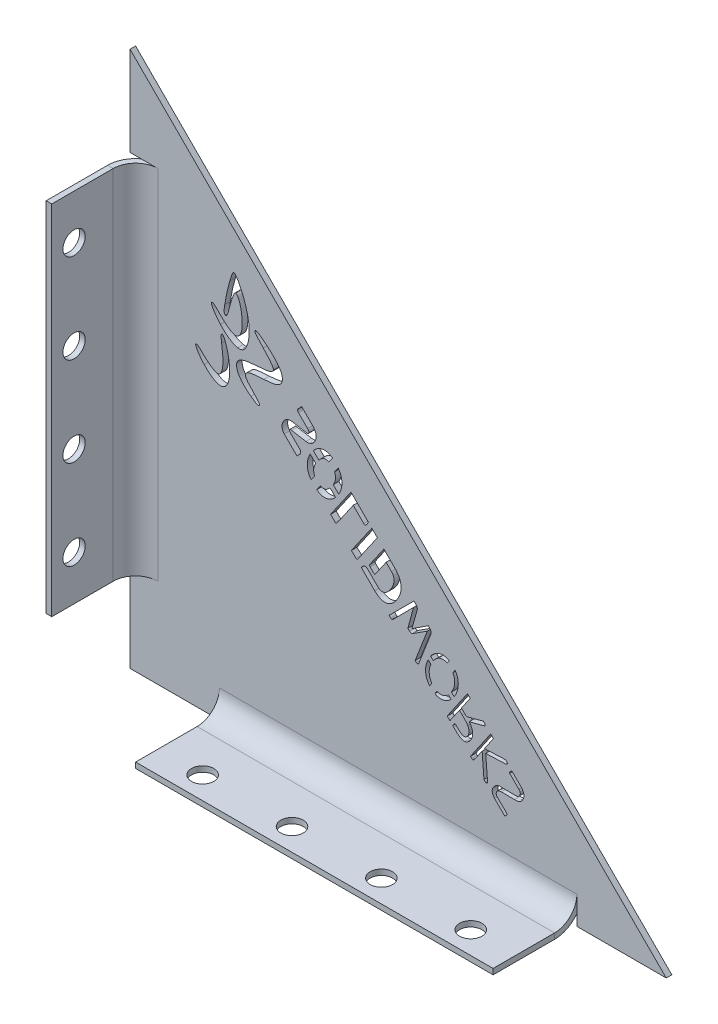
from build123d import *

# Parameters (mm, degrees)
BOSS_EXTRUDE1_DEPTH          = 1.5875
SKETCH7_W                    = 1.5875
SKETCH7_H                    = 101.6
BOSS_EXTRUDE2_DEPTH          = 0.0254
EDGE_FLANGE1_STRIP_W         = 19.05
EDGE_FLANGE1_STRIP_H         = 1.5875
EDGE_FLANGE1_STRIP_CUT_DEPTH = 101.6
EDGE_FLANGE1_DEPTH           = 101.6
SKETCH11_W                   = 101.6
SKETCH11_H                   = 1.5875
BOSS_EXTRUDE3_DEPTH          = 0.0254
EDGE_FLANGE2_STRIP_W         = 19.05
EDGE_FLANGE2_STRIP_H         = 1.5875
EDGE_FLANGE2_STRIP_CUT_DEPTH = 101.6
EDGE_FLANGE2_DEPTH           = 101.6
SKETCH15_R                   = 3.175
CUT_EXTRUDE1_DEPTH           = 2.54
SKETCH16_R                   = 3.175
CUT_EXTRUDE2_DEPTH           = 2.54
CUT_EXTRUDE13_DEPTH          = 2.54


# Sheet-metal steps are written as plain solids
with BuildPart() as part:
    # Sketch1 → Boss-Extrude1 (new body)
    with BuildSketch(Plane.XY):
        Polygon((0, 119.481843199), (0, -32.918156801), (152.4, -32.918156801), align=None)
    extrude(amount=BOSS_EXTRUDE1_DEPTH)

    # Sketch7 → Boss-Extrude2 (add)
    with BuildSketch(Plane.ZY):
        with Locations((0.79375, 43.281843199)):
            Rectangle(SKETCH7_W, SKETCH7_H)
    extrude(amount=BOSS_EXTRUDE2_DEPTH)

    # Edge-Flange1 strip (across the edge) → Edge-Flange1 strip cut (cut)
    with BuildSketch(Plane(origin=(-0.0254, 94.081843199, 1.5875), x_dir=(1, 0, 0), z_dir=(0, -1, 0))):
        with Locations((-1.5875, -0.79375)):
            Rectangle(EDGE_FLANGE1_STRIP_W, EDGE_FLANGE1_STRIP_H)
    extrude(amount=EDGE_FLANGE1_STRIP_CUT_DEPTH, mode=Mode.SUBTRACT)

    # Edge-Flange1 section (across the edge) → Edge-Flange1 (add)
    with BuildSketch(Plane(origin=(-0.0254, 94.081843199, 1.5875), x_dir=(1, 0, 0), z_dir=(0, -1, 0))):
        with BuildLine():
            Line((0, 6.35), (0, 23.8125))
            Line((0, 23.8125), (1.5875, 23.8125))
            Line((1.5875, 23.8125), (1.5875, 6.35))
            ThreePointArc((1.5875, 6.35), (3.447371939, 1.859871939), (7.9375, 0))
            Line((7.9375, 0), (7.9375, -1.5875))
            ThreePointArc((7.9375, -1.5875), (2.324839924, 0.737339924), (0, 6.35))
        make_face()
    extrude(amount=EDGE_FLANGE1_DEPTH)

    # Sketch11 → Boss-Extrude3 (add)
    with BuildSketch(Plane(origin=(0, -32.918156801, 0), x_dir=(-1, 0, 0), z_dir=(0, -1, 0))):
        with Locations((-76.2, -0.79375)):
            Rectangle(SKETCH11_W, SKETCH11_H)
    extrude(amount=BOSS_EXTRUDE3_DEPTH)

    # Edge-Flange2 strip (across the edge) → Edge-Flange2 strip cut (cut)
    with BuildSketch(Plane(origin=(25.4, -32.943556801, 1.5875), x_dir=(0, 1, 0), z_dir=(1, 0, 0))):
        with Locations((-1.5875, -0.79375)):
            Rectangle(EDGE_FLANGE2_STRIP_W, EDGE_FLANGE2_STRIP_H)
    extrude(amount=EDGE_FLANGE2_STRIP_CUT_DEPTH, mode=Mode.SUBTRACT)

    # Edge-Flange2 section (across the edge) → Edge-Flange2 (add)
    with BuildSketch(Plane(origin=(25.4, -32.943556801, 1.5875), x_dir=(0, 1, 0), z_dir=(1, 0, 0))):
        with BuildLine():
            Line((0, 6.35), (0, 23.8125))
            Line((0, 23.8125), (1.5875, 23.8125))
            Line((1.5875, 23.8125), (1.5875, 6.35))
            ThreePointArc((1.5875, 6.35), (3.447371939, 1.859871939), (7.9375, 0))
            Line((7.9375, 0), (7.9375, -1.5875))
            ThreePointArc((7.9375, -1.5875), (2.324839924, 0.737339924), (0, 6.35))
        make_face()
    extrude(amount=EDGE_FLANGE2_DEPTH)

    # Sketch15 → Cut-Extrude1 (cut)
    with BuildSketch(Plane(origin=(0, -31.356056801, 0), x_dir=(1, 0, 0), z_dir=(0, 1, 0))):
        with Locations(Location((38.1, -19.05, 0), (0, 0, 270))):
            Circle(SKETCH15_R)
        with Locations(Location((63.5, -19.05, 0), (0, 0, 270))):
            Circle(SKETCH15_R)
        with Locations(Location((88.9, -19.05, 0), (0, 0, 270))):
            Circle(SKETCH15_R)
        with Locations(Location((114.3, -19.05, 0), (0, 0, 270))):
            Circle(SKETCH15_R)
    extrude(amount=-CUT_EXTRUDE1_DEPTH, mode=Mode.SUBTRACT)

    # Sketch16 → Cut-Extrude2 (cut)
    with BuildSketch(Plane(origin=(1.5621, 0, 0), x_dir=(0, 0, -1), z_dir=(1, 0, 0))):
        with Locations((-19.05, 81.381843199)):
            Circle(SKETCH16_R)
        with Locations((-19.05, 55.981843199)):
            Circle(SKETCH16_R)
        with Locations((-19.05, 30.581843199)):
            Circle(SKETCH16_R)
        with Locations((-19.05, 5.181843199)):
            Circle(SKETCH16_R)
    extrude(amount=-CUT_EXTRUDE2_DEPTH, mode=Mode.SUBTRACT)

    # Sketch17 → Cut-Extrude13 (cut)
    with BuildSketch(Plane.XY):
        with BuildLine():
            Line((84.721707755, 11.622520957), (85.505242554, 10.840701105))
            add(Edge.make_bspline(
                [(85.758282427, 6.326548481), (84.987712449, 7.45790861), (84.704291863, 9.048216028), (85.505242554, 10.840701105)],
                knots=[0.183752031, 0.183752031, 0.183752031, 0.183752031, 0.900404734, 0.900404734, 0.900404734, 0.900404734], degree=3))
            Line((85.758282427, 6.326548481), (85.168963635, 5.374216856))
            add(Edge.make_bspline(
                [(84.721707755, 11.622520957), (83.710532317, 9.544605504), (83.647013648, 7.213000638), (85.168963635, 5.374216856)],
                knots=[0.087575575, 0.087575575, 0.087575575, 0.087575575, 0.889589698, 0.889589698, 0.889589698, 0.889589698], degree=3))
        make_face()
        with BuildLine():
            Line((51.445463807, 39.221199309), (52.510429012, 40.680868742))
            add(Edge.make_bspline(
                [(52.510429012, 40.680868742), (51.997568519, 41.660838846), (52.103698081, 42.720219463), (52.76654826, 43.906113031)],
                knots=[0.215987469, 0.215987469, 0.215987469, 0.215987469, 0.865125096, 0.865125096, 0.865125096, 0.865125096], degree=3))
            Line((52.76654826, 43.906113031), (51.19475958, 45.443832105))
            add(Edge.make_bspline(
                [(51.19475958, 45.443832105), (50.1334678, 43.525079377), (49.985777468, 41.262248875), (51.445463807, 39.221199309)],
                knots=[0.108043754, 0.108043754, 0.108043754, 0.108043754, 0.883180659, 0.883180659, 0.883180659, 0.883180659], degree=3))
        make_face()
        with BuildLine():
            Line((92.11703209, 6.171171914), (91.343664825, 6.942846486))
            add(Edge.make_bspline(
                [(91.360591146, 6.970153244), (91.354954521, 6.961018679), (91.349312399, 6.951916445), (91.343664825, 6.942846486)],
                knots=[0, 0, 0, 0, 0.003649159, 0.003649159, 0.003649159, 0.003649159], degree=3))
            add(Edge.make_bspline(
                [(91.763716495, 11.887071982), (92.477869446, 10.629316693), (92.556518643, 8.91297866), (91.360591146, 6.970153244)],
                knots=[0.239450652, 0.239450652, 0.239450652, 0.239450652, 1, 1, 1, 1], degree=3))
            Line((91.763716495, 11.887071982), (92.381332766, 12.817587465))
            add(Edge.make_bspline(
                [(92.180313996, 6.271756537), (93.463597374, 8.35283708), (93.771196619, 10.816829081), (92.381332766, 12.817587465)],
                knots=[0, 0, 0, 0, 0.836009541, 0.836009541, 0.836009541, 0.836009541], degree=3))
            add(Edge.make_bspline(
                [(92.11703209, 6.171171914), (92.138383386, 6.20447253), (92.159478844, 6.238003186), (92.180313996, 6.271756537)],
                knots=[0.98494769, 0.98494769, 0.98494769, 0.98494769, 1, 1, 1, 1], degree=3))
        make_face()
        with BuildLine():
            Line((93.619394476, 3.631709578), (90.901456611, -0.336750328))
            Line((90.901456611, -0.336750328), (90.138423725, 0.426833781))
            Line((90.138423725, 0.426833781), (95.903726954, 8.821206607))
            Line((95.903726954, 8.821206607), (96.682795231, 8.041575523))
            Line((96.682795231, 8.041575523), (94.189502794, 4.449340015))
            Line((94.189502794, 4.449340015), (95.614058846, 3.036587601))
            Line((95.614058846, 3.036587601), (100.412492775, 4.30918361))
            Line((100.412492775, 4.30918361), (100.808972967, 3.912416997))
            add(Edge.make_bspline(
                [(100.944654432, 3.663274364), (100.929725408, 3.768049176), (100.876299846, 3.84504148), (100.808972967, 3.912416997)],
                knots=[0, 0, 0, 0, 1, 1, 1, 1], degree=3))
            add(Edge.make_bspline(
                [(100.841921854, 3.381078513), (100.910366712, 3.447335278), (100.963860266, 3.560637463), (100.944654432, 3.663274364)],
                knots=[0, 0, 0, 0, 1, 1, 1, 1], degree=3))
            add(Edge.make_bspline(
                [(100.483729752, 3.228330831), (100.740323521, 3.279553524), (100.841921854, 3.381078513)],
                knots=[0, 0, 0, 1, 1, 1], degree=2))
            Line((100.483729752, 3.228330831), (96.408058464, 2.1585972))
            add(Edge.make_bspline(
                [(96.852310832, -2.1317307), (97.243809214, -1.522502732), (98.031270337, 0.215515479), (96.408058464, 2.1585972)],
                knots=[0, 0, 0, 0, 1, 1, 1, 1], degree=3))
            add(Edge.make_bspline(
                [(95.170240864, -3.314580371), (95.843769004, -3.272061019), (96.532479446, -2.630868637), (96.852310832, -2.1317307)],
                knots=[0, 0, 0, 0, 1, 1, 1, 1], degree=3))
            add(Edge.make_bspline(
                [(91.956250184, -1.392305894), (93.030274382, -2.467105977), (93.988893063, -3.394333859), (95.170240864, -3.314580371)],
                knots=[0, 0, 0, 0, 1, 1, 1, 1], degree=3))
            Line((91.956250184, -1.392305894), (91.699567709, -1.135437988))
            Line((91.699567709, -1.135437988), (92.32273585, -0.237403331))
            add(Edge.make_bspline(
                [(93.48822557, -1.385375982), (93.246732808, -1.169082314), (92.763450941, -0.684887464), (92.32273585, -0.237403331)],
                knots=[0, 0, 0, 0, 0.564910355, 0.564910355, 0.564910355, 0.564910355], degree=3))
            add(Edge.make_bspline(
                [(93.921068141, -1.743669219), (93.817395042, -1.672004539), (93.660289486, -1.540452428), (93.48822557, -1.385375982)],
                knots=[0, 0, 0, 0, 1, 1, 1, 1], degree=3))
            add(Edge.make_bspline(
                [(94.883074119, -2.171643467), (94.602980775, -2.167266293), (94.319732567, -2.016425741), (93.921068141, -1.743669219)],
                knots=[0, 0, 0, 0, 1, 1, 1, 1], degree=3))
            add(Edge.make_bspline(
                [(95.977880574, 1.0148503), (96.785586905, -0.394471637), (96.077212099, -2.20093934), (94.883074119, -2.171643467)],
                knots=[0, 0, 0, 0, 1, 1, 1, 1], degree=3))
            add(Edge.make_bspline(
                [(94.446560637, 2.823196427), (95.076013707, 2.193288634), (95.664842256, 1.563394792), (95.977880574, 1.0148503)],
                knots=[0, 0, 0, 0, 1, 1, 1, 1], degree=3))
            add(Edge.make_bspline(
                [(93.619394476, 3.631709578), (93.900460659, 3.358995517), (94.222136695, 3.045643704), (94.446560637, 2.823196427)],
                knots=[0, 0, 0, 0, 1, 1, 1, 1], degree=3))
        make_face()
        with BuildLine():
            Line((86.209196401, 12.066076945), (85.443485586, 12.830111825))
            add(Edge.make_bspline(
                [(90.730488829, 14.361570374), (88.727487913, 15.496506982), (86.72434244, 14.567710628), (85.443485586, 12.830111825)],
                knots=[0.087278425, 0.087278425, 0.087278425, 0.087278425, 0.918005408, 0.918005408, 0.918005408, 0.918005408], degree=3))
            Line((90.730488829, 14.361570374), (90.164071414, 13.446247084))
            add(Edge.make_bspline(
                [(86.209196401, 12.066076945), (87.459941732, 13.821438038), (88.927520745, 14.057479012), (90.164071414, 13.446247084)],
                knots=[0.065880131, 0.065880131, 0.065880131, 0.065880131, 0.862540536, 0.862540536, 0.862540536, 0.862540536], degree=3))
        make_face()
        with BuildLine():
            Line((90.500625434, 5.856251769), (91.25986179, 5.098677177))
            add(Edge.make_bspline(
                [(86.635335403, 4.160530072), (88.316134594, 3.2833491), (90.009378432, 3.845450844), (91.25986179, 5.098677177)],
                knots=[0.104022508, 0.104022508, 0.104022508, 0.104022508, 0.806991479, 0.806991479, 0.806991479, 0.806991479], degree=3))
            Line((86.635335403, 4.160530072), (87.232423338, 5.060117069))
            add(Edge.make_bspline(
                [(90.500625434, 5.856251769), (89.427683871, 4.774352876), (88.253131249, 4.616069243), (87.232423338, 5.060117069)],
                knots=[0.178248537, 0.178248537, 0.178248537, 0.178248537, 0.823949969, 0.823949969, 0.823949969, 0.823949969], degree=3))
        make_face()
        with BuildLine():
            Line((59.173354737, 45.98521522), (58.104637652, 44.520403361))
            add(Edge.make_bspline(
                [(58.104637652, 44.520403361), (58.624312063, 43.509829281), (58.486845573, 42.415026806), (57.758816103, 41.181540941)],
                knots=[0.220601271, 0.220601271, 0.220601271, 0.220601271, 0.889658399, 0.889658399, 0.889658399, 0.889658399], degree=3))
            Line((57.758816103, 41.181540941), (59.331913265, 39.642541746))
            add(Edge.make_bspline(
                [(59.331913265, 39.642541746), (60.45921991, 41.585887069), (60.653244066, 43.90092567), (59.173354737, 45.98521522)],
                knots=[0.08979709, 0.08979709, 0.08979709, 0.08979709, 0.881059413, 0.881059413, 0.881059413, 0.881059413], degree=3))
        make_face()
        with BuildLine():
            Line((53.662340512, 45.189222593), (52.086221637, 46.731178003))
            add(Edge.make_bspline(
                [(57.568679838, 47.613840901), (55.520065822, 49.093943076), (53.553275424, 48.448735158), (52.086221637, 46.731178003)],
                knots=[0.108544123, 0.108544123, 0.108544123, 0.108544123, 0.92409509, 0.92409509, 0.92409509, 0.92409509], degree=3))
            Line((57.568679838, 47.613840901), (56.504063464, 46.154649585))
            add(Edge.make_bspline(
                [(53.662340512, 45.189222593), (54.61089034, 46.300828986), (55.536870486, 46.648456561), (56.504063464, 46.154649585)],
                knots=[0.099972059, 0.099972059, 0.099972059, 0.099972059, 0.794712313, 0.794712313, 0.794712313, 0.794712313], degree=3))
        make_face()
        with BuildLine():
            Line((56.84156153, 39.919428489), (58.418387809, 38.376781009))
            add(Edge.make_bspline(
                [(53.054081382, 37.597977564), (55.04976389, 36.166398246), (56.967204324, 36.750170518), (58.418387809, 38.376781009)],
                knots=[0.110680721, 0.110680721, 0.110680721, 0.110680721, 0.905933238, 0.905933238, 0.905933238, 0.905933238], degree=3))
            Line((53.054081382, 37.597977564), (54.119183475, 39.05783462))
            add(Edge.make_bspline(
                [(56.84156153, 39.919428489), (55.935669711, 38.906003102), (55.046091738, 38.595436594), (54.119183475, 39.05783462)],
                knots=[0.124259191, 0.124259191, 0.124259191, 0.124259191, 0.79018155, 0.79018155, 0.79018155, 0.79018155], degree=3))
        make_face()
        with BuildLine():
            Line((108.496762476, -3.86941452), (111.3864901, -6.767368702))
            add(Edge.make_bspline(
                [(111.3864901, -6.767368702), (112.561547128, -8.376297819), (111.244223221, -9.960736931)],
                knots=[0, 0, 0, 1, 1, 1], degree=2))
            add(Edge.make_bspline(
                [(111.244223221, -9.960736931), (110.391101426, -10.65173837), (109.268361741, -10.567012718)],
                knots=[0, 0, 0, 1, 1, 1], degree=2))
            Line((109.268361741, -10.567012718), (105.526638444, -10.526041213))
            add(Edge.make_bspline(
                [(105.526638444, -10.526041213), (104.930541488, -10.516484149), (104.41789044, -10.870435939)],
                knots=[0, 0, 0, 1, 1, 1], degree=2))
            add(Edge.make_bspline(
                [(104.41789044, -10.870435939), (103.685620288, -11.673429456), (104.49427114, -12.502306534)],
                knots=[0, 0, 0, 1, 1, 1], degree=2))
            Line((104.49427114, -12.502306534), (107.122144424, -15.101175717))
            add(Edge.make_bspline(
                [(107.071688836, -15.499933962), (107.270701008, -15.330066072), (107.122144424, -15.101175717)],
                knots=[0, 0, 0, 1, 1, 1], degree=2))
            Line((107.071688836, -15.499933962), (106.534891807, -16.040425924))
            Line((106.534891807, -16.040425924), (103.615255498, -13.140748949))
            add(Edge.make_bspline(
                [(103.753238565, -9.960736931), (102.194590608, -11.376548682), (103.615255498, -13.140748949)],
                knots=[0, 0, 0, 1, 1, 1], degree=2))
            add(Edge.make_bspline(
                [(105.536650499, -9.370683255), (104.526262329, -9.287104603), (103.753238565, -9.960736931)],
                knots=[0, 0, 0, 1, 1, 1], degree=2))
            Line((105.536650499, -9.370683255), (109.472939745, -9.442971907))
            add(Edge.make_bspline(
                [(110.583848929, -9.062941846), (110.107843335, -9.464729066), (109.472939745, -9.442971907)],
                knots=[0, 0, 0, 1, 1, 1], degree=2))
            add(Edge.make_bspline(
                [(110.504262199, -7.39076176), (111.268971199, -8.185243143), (110.583848929, -9.062941846)],
                knots=[0, 0, 0, 1, 1, 1], degree=2))
            Line((110.504262199, -7.39076176), (107.891736672, -4.775452968))
            add(Edge.make_bspline(
                [(107.962033037, -4.394671871), (107.825859644, -4.565027913), (107.891736672, -4.775452968)],
                knots=[0, 0, 0, 1, 1, 1], degree=2))
            Line((107.962033037, -4.394671871), (108.496762476, -3.86941452))
        make_face()
        with BuildLine():
            Line((70.290623891, 34.388644753), (64.698621503, 26.304238707))
            add(Edge.make_bspline(
                [(64.698621503, 26.304238707), (64.605563614, 26.168501602), (64.393873546, 26.127952794), (64.251738703, 26.270190316)],
                knots=[0, 0, 0, 0, 1, 1, 1, 1], degree=3))
            Line((64.251738703, 26.270190316), (62.928711555, 27.594173231))
            Line((62.928711555, 27.594173231), (68.717525169, 35.962879897))
            Line((68.717525169, 35.962879897), (70.290623891, 34.388644753))
        make_face()
        with BuildLine():
            Line((67.777086105, 36.903998342), (67.199488157, 36.068196006))
            add(Edge.make_bspline(
                [(67.199488157, 36.068196006), (66.939568961, 35.693047315), (66.707575098, 35.674957198), (66.436130334, 35.946598057)],
                knots=[0, 0, 0, 0, 1, 1, 1, 1], degree=3))
            Line((66.436130334, 35.946598057), (63.429930485, 38.954969613))
            Line((63.429930485, 38.954969613), (58.77919786, 32.230078827))
            add(Edge.make_bspline(
                [(58.77919786, 32.230078827), (58.684002723, 32.096479077), (58.473381997, 32.054861591), (58.332315779, 32.196029717)],
                knots=[0, 0, 0, 0, 1, 1, 1, 1], degree=3))
            Line((58.332315779, 32.196029717), (57.00928863, 33.520012632))
            Line((57.00928863, 33.520012632), (62.797032129, 41.887649956))
            Line((62.797032129, 41.887649956), (67.777086105, 36.903998342))
        make_face()
        with BuildLine():
            Line((72.146922955, 32.531004681), (75.129611648, 29.546161265))
            add(Edge.make_bspline(
                [(75.129611648, 29.546161265), (77.33216344, 27.342018329), (77.8304891, 24.768593971), (75.689100546, 21.677624277)],
                knots=[0, 0, 0, 0, 1, 1, 1, 1], degree=3))
            add(Edge.make_bspline(
                [(75.689100546, 21.677624277), (74.046154195, 19.300611921), (71.7934214, 18.723059435), (69.547053885, 20.971049748)],
                knots=[0, 0, 0, 0, 1, 1, 1, 1], degree=3))
            Line((69.547053885, 20.971049748), (65.738273885, 24.782581247))
            Line((65.738273885, 24.782581247), (65.83346974, 24.916180279))
            add(Edge.make_bspline(
                [(65.83346974, 24.916180279), (66.224953453, 25.484783007), (66.82167998, 26.001996286), (67.581512314, 25.241615042)],
                knots=[0, 0, 0, 0, 1, 1, 1, 1], degree=3))
            Line((67.581512314, 25.241615042), (70.402830221, 22.418258988))
            add(Edge.make_bspline(
                [(70.402830221, 22.418258988), (71.519602237, 21.300680205), (72.755580871, 21.680821515), (73.996346572, 23.474268868)],
                knots=[0, 0, 0, 0, 1, 1, 1, 1], degree=3))
            add(Edge.make_bspline(
                [(73.996346572, 23.474268868), (75.132289541, 25.118084082), (75.446179402, 26.927901252), (74.309102819, 28.06579927)],
                knots=[0, 0, 0, 0, 1, 1, 1, 1], degree=3))
            Line((74.309102819, 28.06579927), (72.779820538, 29.596186318))
            Line((72.779820538, 29.596186318), (69.52281134, 24.890259491))
            Line((69.52281134, 24.890259491), (68.222226725, 26.191783661))
            add(Edge.make_bspline(
                [(68.222226725, 26.191783661), (68.046962396, 26.367174603), (68.053466727, 26.615196168), (68.146523844, 26.748795253)],
                knots=[0, 0, 0, 0, 1, 1, 1, 1], degree=3))
            Line((68.146523844, 26.748795253), (72.146922955, 32.531004681))
        make_face()
        with BuildLine():
            Line((47.444592965, 43.091617925), (43.813214541, 46.725619691))
            add(Edge.make_bspline(
                [(43.813214541, 46.725619691), (43.007429236, 47.531987103), (43.023978935, 48.957047288), (43.714940058, 49.90826821)],
                knots=[0, 0, 0, 0, 1, 1, 1, 1], degree=3))
            add(Edge.make_bspline(
                [(43.714940058, 49.90826821), (44.196258752, 50.566639632), (45.04099995, 51.060243708), (46.119619033, 50.868491442)],
                knots=[0, 0, 0, 0, 1, 1, 1, 1], degree=3))
            Line((46.119619033, 50.868491442), (49.960530836, 50.183969994))
            add(Edge.make_bspline(
                [(49.960530836, 50.183969994), (50.361403643, 50.110059983), (50.592321108, 50.105700566), (50.75489871, 50.325869368)],
                knots=[0, 0, 0, 0, 1, 1, 1, 1], degree=3))
            add(Edge.make_bspline(
                [(50.75489871, 50.325869368), (50.9763067, 50.632611748), (50.945391662, 50.877439795), (50.476240755, 51.346929622)],
                knots=[0, 0, 0, 0, 1, 1, 1, 1], degree=3))
            Line((50.476240755, 51.346929622), (47.846216531, 53.9788538))
            add(Edge.make_bspline(
                [(47.846216531, 53.9788538), (47.565153435, 54.260119938), (47.550291578, 54.550911046), (47.816622516, 54.919643363)],
                knots=[0, 0, 0, 0, 1, 1, 1, 1], degree=3))
            Line((47.816622516, 54.919643363), (48.797310754, 55.899623655))
            Line((48.797310754, 55.899623655), (51.878318566, 52.816390093))
            add(Edge.make_bspline(
                [(51.878318566, 52.816390093), (53.229131365, 51.464601454), (53.100314908, 50.00002629), (52.387961347, 49.018879381)],
                knots=[0, 0, 0, 0, 1, 1, 1, 1], degree=3))
            add(Edge.make_bspline(
                [(52.387961347, 49.018879381), (51.717323266, 48.096517257), (50.881203628, 47.795341883), (50.000346275, 47.943191188)],
                knots=[0, 0, 0, 0, 1, 1, 1, 1], degree=3))
            Line((50.000346275, 47.943191188), (45.890035082, 48.642776045))
            add(Edge.make_bspline(
                [(45.890035082, 48.642776045), (45.557575535, 48.697418459), (45.437830782, 48.673942045), (45.346917088, 48.555308322)],
                knots=[0, 0, 0, 0, 1, 1, 1, 1], degree=3))
            add(Edge.make_bspline(
                [(45.346917088, 48.555308322), (45.195039565, 48.360792609), (45.281550662, 48.130912779), (45.555133392, 47.857132411)],
                knots=[0, 0, 0, 0, 1, 1, 1, 1], degree=3))
            Line((45.555133392, 47.857132411), (48.301643336, 45.108638361))
            add(Edge.make_bspline(
                [(48.301643336, 45.108638361), (48.637209827, 44.772829454), (48.485208834, 44.238350721), (48.198557117, 43.845037799)],
                knots=[0, 0, 0, 0, 1, 1, 1, 1], degree=3))
            Line((48.198557117, 43.845037799), (47.444592965, 43.091617925))
        make_face()
        with BuildLine():
            Line((101.073637243, -3.295330304), (101.62070499, -10.032790136))
            add(Edge.make_bspline(
                [(101.62070499, -10.032790136), (101.635603133, -10.223088591), (101.467698679, -10.390871837)],
                knots=[0, 0, 0, 1, 1, 1], degree=2))
            add(Edge.make_bspline(
                [(101.467698679, -10.390871837), (101.401391786, -10.459268112), (101.29019051, -10.510543302), (101.186497338, -10.494469996)],
                knots=[0, 0, 0, 0, 1, 1, 1, 1], degree=3))
            add(Edge.make_bspline(
                [(101.186497338, -10.494469996), (101.081733333, -10.479465314), (101.005851289, -10.420638786), (100.937455014, -10.354331893)],
                knots=[0, 0, 0, 0, 1, 1, 1, 1], degree=3))
            Line((100.937455014, -10.354331893), (100.592270911, -10.008898425))
            Line((100.592270911, -10.008898425), (100.067661136, -3.251135517))
            Line((100.067661136, -3.251135517), (97.797931747, -6.487451382))
            add(Edge.make_bspline(
                [(97.797931747, -6.487451382), (97.674922448, -6.670217693), (97.497447422, -6.700087321), (97.391615566, -6.681875224)],
                knots=[0, 0, 0, 0, 1, 1, 1, 1], degree=3))
            add(Edge.make_bspline(
                [(97.391615566, -6.681875224), (97.278300203, -6.666866735), (97.17248219, -6.612306155), (97.094468357, -6.534235964)],
                knots=[0, 0, 0, 0, 1, 1, 1, 1], degree=3))
            Line((97.094468357, -6.534235964), (96.743941135, -6.183455518))
            Line((96.743941135, -6.183455518), (102.50924282, 2.206639833))
            Line((102.50924282, 2.206639833), (103.287242473, 1.428078144))
            Line((103.287242473, 1.428078144), (100.729764178, -2.27959227))
            Line((100.729764178, -2.27959227), (106.748702668, -2.031603621))
            Line((106.748702668, -2.031603621), (107.093886771, -2.377037089))
            add(Edge.make_bspline(
                [(107.093886771, -2.377037089), (107.160142765, -2.447619967), (107.21677646, -2.523543701), (107.230636141, -2.627248399)],
                knots=[0, 0, 0, 0, 1, 1, 1, 1], degree=3))
            add(Edge.make_bspline(
                [(107.230636141, -2.627248399), (107.24877407, -2.728816622), (107.197417046, -2.84425688), (107.127904282, -2.909444968)],
                knots=[0, 0, 0, 0, 1, 1, 1, 1], degree=3))
            add(Edge.make_bspline(
                [(107.127904282, -2.909444968), (107.000639017, -3.036618361), (106.768642839, -3.061122536)],
                knots=[0, 0, 0, 1, 1, 1], degree=2))
            Line((106.768642839, -3.061122536), (101.073637243, -3.295330304))
        make_face()
        with BuildLine():
            Line((85.489060514, 18.220998173), (82.076602895, 9.352180046))
            add(Edge.make_bspline(
                [(82.076602895, 9.352180046), (82.045575088, 9.282701304), (82.02845246, 9.233530883), (81.965353753, 9.168340478)],
                knots=[0, 0, 0, 0, 1, 1, 1, 1], degree=3))
            add(Edge.make_bspline(
                [(81.965353753, 9.168340478), (81.893698391, 9.092462348), (81.76645706, 9.031571862), (81.652072301, 9.04551029)],
                knots=[0, 0, 0, 0, 1, 1, 1, 1], degree=3))
            add(Edge.make_bspline(
                [(81.652072301, 9.04551029), (81.534480128, 9.058382303), (81.453252703, 9.118279053), (81.383787858, 9.187794079)],
                knots=[0, 0, 0, 0, 1, 1, 1, 1], degree=3))
            Line((81.383787858, 9.187794079), (81.027917518, 9.543921504))
            Line((81.027917518, 9.543921504), (84.509901798, 18.516414939))
            Line((84.509901798, 18.516414939), (80.457191211, 15.89866355))
            add(Edge.make_bspline(
                [(80.457191211, 15.89866355), (80.122482527, 15.647553461), (79.687385361, 15.682989323), (79.425569789, 15.977077346)],
                knots=[0, 0, 0, 0, 1, 1, 1, 1], degree=3))
            Line((79.425569789, 15.977077346), (78.963899247, 16.439081404))
            Line((78.963899247, 16.439081404), (80.57285425, 22.383583415))
            Line((80.57285425, 22.383583415), (74.701541405, 16.473761171))
            add(Edge.make_bspline(
                [(74.701541405, 16.473761171), (74.624539065, 16.392539923), (74.497296907, 16.327372679), (74.373290012, 16.342385029)],
                knots=[0, 0, 0, 0, 1, 1, 1, 1], degree=3))
            add(Edge.make_bspline(
                [(74.373290012, 16.342385029), (74.250351686, 16.354189244), (74.160572956, 16.416227101), (74.08469637, 16.492158501)],
                knots=[0, 0, 0, 0, 1, 1, 1, 1], degree=3))
            Line((74.08469637, 16.492158501), (73.621957203, 16.955231954))
            Line((73.621957203, 16.955231954), (80.701736329, 24.029900273))
            Line((80.701736329, 24.029900273), (81.29164817, 23.439562273))
            Line((81.29164817, 23.439562273), (81.290578775, 23.43849365))
            add(Edge.make_bspline(
                [(81.290578775, 23.43849365), (81.293785364, 23.435284744), (81.300197878, 23.43100639), (81.304472372, 23.426728807)],
                knots=[0, 0, 0, 0, 1, 1, 1, 1], degree=3))
            add(Edge.make_bspline(
                [(81.304472372, 23.426728807), (81.479738246, 23.255615341), (81.592986442, 23.054589121), (81.62818601, 22.833279178)],
                knots=[0, 0, 0, 0, 1, 1, 1, 1], degree=3))
            add(Edge.make_bspline(
                [(81.62818601, 22.833279178), (81.661254561, 22.633352355), (81.645140337, 22.416336979), (81.593743114, 22.187575236)],
                knots=[0, 0, 0, 0, 1, 1, 1, 1], degree=3))
            Line((81.593743114, 22.187575236), (80.102623419, 16.901575892))
            Line((80.102623419, 16.901575892), (84.757381315, 19.971325451))
            Line((84.757381315, 19.971325451), (85.248974755, 19.479376878))
            Line((85.248974755, 19.479376878), (85.263936204, 19.464404621))
            add(Edge.make_bspline(
                [(85.263936204, 19.464404621), (85.586677775, 19.141429898), (85.668830227, 18.682770623), (85.489060514, 18.220998173)],
                knots=[0, 0, 0, 0, 1, 1, 1, 1], degree=3))
        make_face()
        with BuildLine():
            add(Edge.make_bspline(
                [(20.72110866, 54.906976215), (20.284017897, 55.344382737), (19.231436318, 56.58808724), (18.735295858, 56.329552373)],
                knots=[0, 0, 0, 0, 1, 1, 1, 1], degree=3))
            add(Edge.make_bspline(
                [(18.735295858, 56.329552373), (18.328972676, 56.11374762), (19.465757433, 54.167635225), (21.080479871, 52.402022247)],
                knots=[0, 0, 0, 0, 1, 1, 1, 1], degree=3))
            add(Edge.make_bspline(
                [(21.080479871, 52.402022247), (22.708027229, 50.623575085), (25.060439679, 48.947497596), (26.56061046, 49.694233975)],
                knots=[0, 0, 0, 0, 1, 1, 1, 1], degree=3))
            add(Edge.make_bspline(
                [(26.56061046, 49.694233975), (29.016700501, 50.919567431), (28.584753446, 56.722620159), (27.188940356, 60.758852952)],
                knots=[0, 0, 0, 0, 1, 1, 1, 1], degree=3))
            add(Edge.make_bspline(
                [(27.188940356, 60.758852952), (26.845058028, 61.748933319), (26.530930242, 62.240817813), (26.339619628, 62.387349129)],
                knots=[0, 0, 0, 0, 1, 1, 1, 1], degree=3))
            add(Edge.make_bspline(
                [(26.339619628, 62.387349129), (26.158997458, 62.525324509), (25.983625045, 62.401375515), (25.933323466, 62.24637936)],
                knots=[0, 0, 0, 0, 1, 1, 1, 1], degree=3))
            add(Edge.make_bspline(
                [(25.933323466, 62.24637936), (25.835933952, 61.956696357), (25.880533422, 61.122808818), (26.037320131, 60.108207346)],
                knots=[0, 0, 0, 0, 1, 1, 1, 1], degree=3))
            add(Edge.make_bspline(
                [(26.037320131, 60.108207346), (26.859659941, 54.814958612), (26.214061907, 52.182078439), (24.972842941, 52.09593251)],
                knots=[0, 0, 0, 0, 1, 1, 1, 1], degree=3))
            add(Edge.make_bspline(
                [(24.972842941, 52.09593251), (24.176368701, 52.041697007), (22.33054274, 53.296379465), (20.72110866, 54.906976215)],
                knots=[0, 0, 0, 0, 1, 1, 1, 1], degree=3))
        make_face()
        with BuildLine():
            add(Edge.make_bspline(
                [(32.830968937, 62.312308296), (32.332463429, 61.423024759), (31.389448716, 61.156098449), (30.580219757, 61.307129638)],
                knots=[0, 0, 0, 0, 1, 1, 1, 1], degree=3))
            add(Edge.make_bspline(
                [(30.580219757, 61.307129638), (28.954277721, 61.610262291), (27.014462614, 63.108725843), (25.673320697, 64.598420432)],
                knots=[0, 0, 0, 0, 1, 1, 1, 1], degree=3))
            add(Edge.make_bspline(
                [(25.673320697, 64.598420432), (24.479651337, 65.925564388), (22.714479817, 68.494101122), (23.194605645, 68.811440902)],
                knots=[0, 0, 0, 0, 1, 1, 1, 1], degree=3))
            add(Edge.make_bspline(
                [(23.194605645, 68.811440902), (23.702540284, 69.165118408), (24.93997673, 67.659424681), (25.568361176, 67.030586283)],
                knots=[0, 0, 0, 0, 1, 1, 1, 1], degree=3))
            add(Edge.make_bspline(
                [(25.568361176, 67.030586283), (26.950165496, 65.647783735), (29.227585523, 63.537691653), (30.463624322, 64.082469783)],
                knots=[0, 0, 0, 0, 1, 1, 1, 1], degree=3))
            add(Edge.make_bspline(
                [(30.463624322, 64.082469783), (33.128163819, 65.255343622), (31.524423847, 73.753937457), (30.115663172, 74.500655886)],
                knots=[0, 0, 0, 0, 1, 1, 1, 1], degree=3))
            add(Edge.make_bspline(
                [(30.115663172, 74.500655886), (29.479691049, 74.839779573), (28.450878871, 70.857875612), (28.085808779, 69.422250453)],
                knots=[0, 0, 0, 0, 1, 1, 1, 1], degree=3))
            add(Edge.make_bspline(
                [(28.085808779, 69.422250453), (27.866341116, 68.566006901), (27.506653568, 67.236216794), (27.035324442, 67.592385907)],
                knots=[0, 0, 0, 0, 1, 1, 1, 1], degree=3))
            add(Edge.make_bspline(
                [(27.035324442, 67.592385907), (26.508417946, 67.991338352), (26.794330641, 69.296566437), (26.921834515, 70.086560996)],
                knots=[0, 0, 0, 0, 1, 1, 1, 1], degree=3))
            add(Edge.make_bspline(
                [(26.921834515, 70.086560996), (27.268986652, 72.230984171), (27.709196678, 74.511145887), (28.36851306, 76.646904988)],
                knots=[0, 0, 0, 0, 1, 1, 1, 1], degree=3))
            add(Edge.make_bspline(
                [(28.36851306, 76.646904988), (28.571874219, 77.307514792), (29.114633853, 79.3631345), (29.542227494, 79.271040957)],
                knots=[0, 0, 0, 0, 1, 1, 1, 1], degree=3))
            add(Edge.make_bspline(
                [(29.542227494, 79.271040957), (29.940957649, 79.184302166), (30.873756483, 77.805937781), (31.760340738, 75.753008285)],
                knots=[0, 0, 0, 0, 1, 1, 1, 1], degree=3))
            add(Edge.make_bspline(
                [(31.760340738, 75.753008285), (34.549346189, 69.302318378), (34.244118945, 64.838004602), (32.830968937, 62.312308296)],
                knots=[0, 0, 0, 0, 1, 1, 1, 1], degree=3))
        make_face()
        with BuildLine():
            add(Edge.make_bspline(
                [(36.662371828, 50.097901477), (36.174817361, 49.931303377), (35.368953363, 50.521718633), (34.373910488, 51.23728424)],
                knots=[0, 0, 0, 0, 1, 1, 1, 1], degree=3))
            add(Edge.make_bspline(
                [(34.373910488, 51.23728424), (32.623232569, 52.495138654), (29.840317839, 55.089701259), (30.33079228, 57.41795242)],
                knots=[0, 0, 0, 0, 1, 1, 1, 1], degree=3))
            add(Edge.make_bspline(
                [(30.33079228, 57.41795242), (30.709890356, 59.215986938), (33.542972911, 59.364633253), (36.209306157, 59.586036752)],
                knots=[0, 0, 0, 0, 1, 1, 1, 1], degree=3))
            add(Edge.make_bspline(
                [(36.209306157, 59.586036752), (38.345366401, 59.762729716), (40.516655604, 59.801501954), (40.727652971, 60.882252826)],
                knots=[0, 0, 0, 0, 1, 1, 1, 1], degree=3))
            add(Edge.make_bspline(
                [(40.727652971, 60.882252826), (40.901159997, 61.765239653), (38.622731564, 64.043175252), (37.880028036, 64.869832508)],
                knots=[0, 0, 0, 0, 1, 1, 1, 1], degree=3))
            add(Edge.make_bspline(
                [(37.880028036, 64.869832508), (36.978097863, 65.872943207), (35.609119342, 67.249327066), (35.500208174, 67.619263884)],
                knots=[0, 0, 0, 0, 1, 1, 1, 1], degree=3))
            add(Edge.make_bspline(
                [(35.500208174, 67.619263884), (35.40090381, 67.949640997), (35.64054783, 68.428496703), (36.590709447, 67.766401381)],
                knots=[0, 0, 0, 0, 1, 1, 1, 1], degree=3))
            add(Edge.make_bspline(
                [(36.590709447, 67.766401381), (37.354901145, 67.234798864), (39.133356993, 65.927757098), (40.758819655, 64.298979957)],
                knots=[0, 0, 0, 0, 1, 1, 1, 1], degree=3))
            add(Edge.make_bspline(
                [(40.758819655, 64.298979957), (42.456953805, 62.599619059), (43.961456244, 60.535776352), (43.032891073, 58.83415614)],
                knots=[0, 0, 0, 0, 1, 1, 1, 1], degree=3))
            add(Edge.make_bspline(
                [(43.032891073, 58.83415614), (42.287257427, 57.467088609), (40.076406976, 57.414433529), (37.979894856, 57.215275643)],
                knots=[0, 0, 0, 0, 1, 1, 1, 1], degree=3))
            add(Edge.make_bspline(
                [(37.979894856, 57.215275643), (35.685597126, 56.995875113), (33.737813069, 57.152662454), (32.93565988, 56.173686707)],
                knots=[0, 0, 0, 0, 1, 1, 1, 1], degree=3))
            add(Edge.make_bspline(
                [(32.93565988, 56.173686707), (32.309981032, 55.413805736), (33.628704403, 54.014990099), (35.841914584, 51.721041465)],
                knots=[0, 0, 0, 0, 1, 1, 1, 1], degree=3))
            add(Edge.make_bspline(
                [(35.841914584, 51.721041465), (36.301440985, 51.244071327), (37.211941656, 50.287996837), (36.662371828, 50.097901477)],
                knots=[0, 0, 0, 0, 1, 1, 1, 1], degree=3))
        make_face()
    extrude(amount=CUT_EXTRUDE13_DEPTH, mode=Mode.SUBTRACT)


solid = part.part
